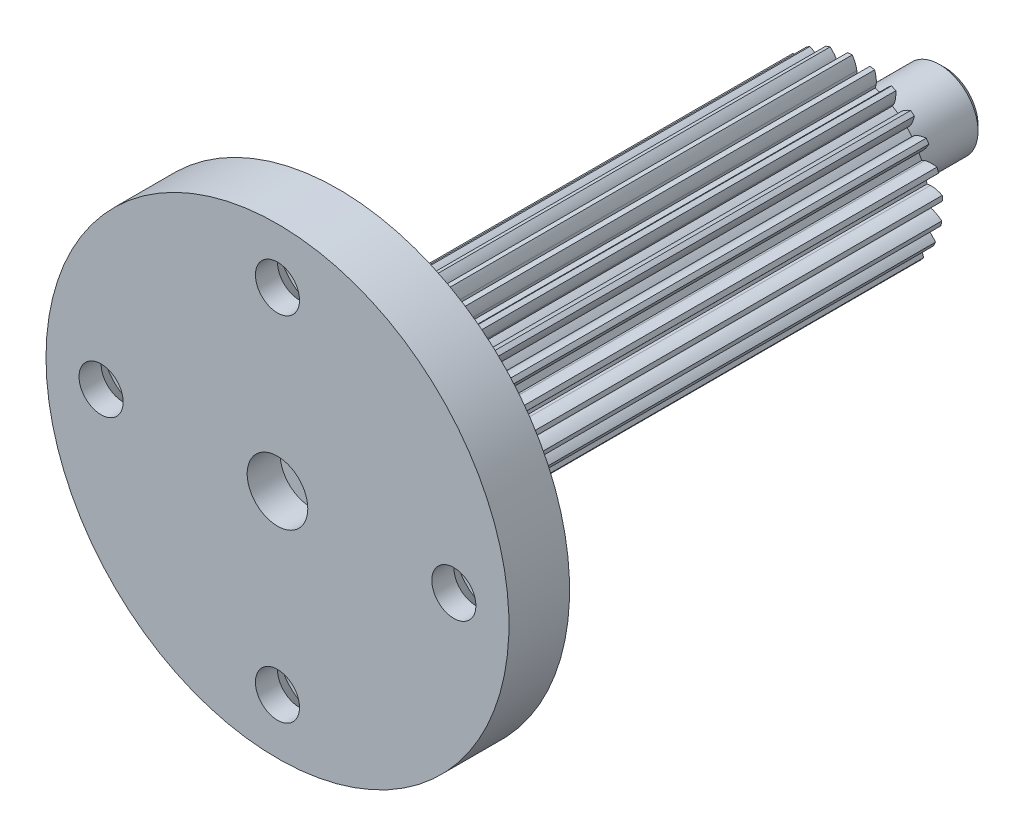
from build123d import *

# Parameters (mm, degrees)
SKETCH1_R           = 7.8
BOSS_EXTRUDE1_DEPTH = 24.27828758
CUT_EXTRUDE1_DEPTH  = 27.66674423
CIRPATTERN2_COUNT   = 24
SKETCH3_W           = 21
SKETCH3_H           = 4
CHAMFER1_SIZE       = 0.5
CHAMFER2_SIZE       = 0.5
SKETCH4_R           = 1.5
CUT_EXTRUDE2_DEPTH  = 68.447007373
SKETCH5_R           = 2.75
CUT_EXTRUDE3_DEPTH  = 3
SKETCH6_R           = 2
CUT_EXTRUDE4_DEPTH  = 64.879935835
CIRPATTERN3_COUNT   = 4
SKETCH9_R           = 21
SKETCH9_R_2         = 4
SKETCH9_R_3         = 1.5
BOSS_EXTRUDE2_DEPTH = 1.5


with BuildPart() as part:
    # Sketch1 → Boss-Extrude1 (new, symmetric)
    with BuildSketch(Plane.XY):
        Circle(SKETCH1_R)
    extrude(amount=BOSS_EXTRUDE1_DEPTH, both=True)

    # Sketch2 → Cut-Extrude1 (cut, symmetric)
    with BuildSketch(Plane.XY):
        with BuildLine():
            add(Edge.make_bspline(
                [(6.76578687, 0), (6.76809978, 3.3276e-05), (6.77458529, 0.000229652), (6.794601126, 0.001500861), (6.833998566, 0.005878077), (6.882442963, 0.013960538), (6.937880972, 0.025803911), (6.991116806, 0.039235092), (7.036448816, 0.051955872), (7.081479524, 0.06579295), (7.126153643, 0.080609438), (7.180031591, 0.099771972), (7.244294587, 0.124436007), (7.318858047, 0.155705553), (7.402735307, 0.194039552), (7.48741219, 0.236150228), (7.570046617, 0.280079073), (7.652678702, 0.327298721), (7.716306472, 0.365549898), (7.760956419, 0.393791216), (7.784989854, 0.409279886), (7.789114217, 0.411946256)],
                knots=[0, 0, 0, 0, 0, 0.005376749, 0.015083688, 0.04661014, 0.092110525, 0.119476176, 0.146842496, 0.174208854, 0.201574956, 0.228941013, 0.256307345, 0.307035032, 0.361767352, 0.416499661, 0.471231937, 0.525964282, 0.580696616, 0.635428982, 0.646811093, 0.646811093, 0.646811093, 0.646811093, 0.646811093], degree=4))
            Line((6.76578687, 0), (6.45, 0))
            ThreePointArc((6.45, 0), (6.441762383, -0.325879434), (6.417070572, -0.650926474))
            Line((6.417070572, -0.650926474), (6.731245243, -0.682795316))
            add(Edge.make_bspline(
                [(6.731245243, -0.682795316), (6.733542987, -0.683061838), (6.739975568, -0.683911722), (6.759760928, -0.687196416), (6.798515487, -0.695527228), (6.845896887, -0.708457378), (6.899856646, -0.725835026), (6.951465235, -0.744570134), (6.995282043, -0.761800823), (7.038686432, -0.780111706), (7.081637212, -0.79936101), (7.133306235, -0.823863012), (7.194752081, -0.854886476), (7.265779182, -0.893521238), (7.345359598, -0.940124324), (7.425354417, -0.990565504), (7.50313372, -1.042609447), (7.580578588, -1.097927156), (7.640021253, -1.142404288), (7.681593166, -1.175007445), (7.703940804, -1.192842466), (7.707775023, -1.195911449)],
                knots=[0, 0, 0, 0, 0, 0.005376749, 0.015083688, 0.04661014, 0.092110525, 0.119476176, 0.146842496, 0.174208854, 0.201574956, 0.228941013, 0.256307345, 0.307035032, 0.361767352, 0.416499661, 0.471231937, 0.525964282, 0.580696616, 0.635428982, 0.646811093, 0.646811093, 0.646811093, 0.646811093, 0.646811093], degree=4))
            ThreePointArc((7.707775023, -1.195911449), (7.776909578, -0.599731115), (7.8, 0))
            ThreePointArc((7.8, 0), (7.797278079, 0.20604503), (7.789114217, 0.411946256))
        make_face()
    cut_extrude1 = extrude(amount=CUT_EXTRUDE1_DEPTH, both=True, mode=Mode.SUBTRACT)

    # CirPattern2: Cut-Extrude1 ×24 about axis
    cirpattern2_axis = Axis((0, 0, -24.27828758), (0, 0, 1))
    for i in range(1, CIRPATTERN2_COUNT):
        add(cut_extrude1.rotate(cirpattern2_axis, i * 360 / CIRPATTERN2_COUNT), mode=Mode.SUBTRACT)

    # Sketch3 → Revolve1 (revolve)
    with BuildSketch(Plane(origin=(0, 0, 0), x_dir=(1, 0, 0), z_dir=(0, 1, 0))):
        Polygon((0, 24.27828758), (0, 32.27828758), (-3.5, 32.27828758), (-3.5, 25.77828758), (-4, 25.77828758), (-4, 24.27828758), align=None)
        with Locations((-10.5, -26.27828758)):
            Rectangle(SKETCH3_W, SKETCH3_H)
    revolve(axis=Axis((0, 0, -24.27828758), (0, 0, 1)))

    # Chamfer1
    chamfer1_edges = [part.edges().sort_by_distance(p)[0] for p in [
        (4, 0, -24.27828758),
    ]]
    chamfer(chamfer1_edges, length=CHAMFER1_SIZE)

    # Chamfer2
    chamfer2_edges = [part.edges().sort_by_distance(p)[0] for p in [
        (3.5, 0, -32.27828758),
    ]]
    chamfer(chamfer2_edges, length=CHAMFER2_SIZE)

    # Sketch4 → Cut-Extrude2 (cut, through all)
    with BuildSketch(Plane.XY.offset(28.27828758)):
        Circle(SKETCH4_R)
    extrude(amount=-CUT_EXTRUDE2_DEPTH, mode=Mode.SUBTRACT)

    # Sketch5 → Cut-Extrude3 (cut)
    with BuildSketch(Plane.XY.offset(28.27828758)):
        Circle(SKETCH5_R)
    extrude(amount=-CUT_EXTRUDE3_DEPTH, mode=Mode.SUBTRACT)

    # Sketch6 → Cut-Extrude4 (cut, through all)
    with BuildSketch(Plane(origin=(0, 0, 24.27828758), x_dir=(-1, 0, 0), z_dir=(0, 0, -1))):
        with Locations((0, 16)):
            Circle(SKETCH6_R)
        with Locations((16, 0)):
            Circle(SKETCH6_R)
        with Locations((0, -16)):
            Circle(SKETCH6_R)
        with Locations((-16, 0)):
            Circle(SKETCH6_R)
    extrude(amount=-CUT_EXTRUDE4_DEPTH, mode=Mode.SUBTRACT)

    # Sketch7 → Cut-Revolve1 (revolve, cut)
    with BuildSketch(Plane(origin=(0, 0, 0), x_dir=(1, 0, 0), z_dir=(0, 1, 0))):
        Polygon((20, -24.27828758), (16, -24.27828758), (16, -26.27828758), (18, -26.27828758), align=None)
    cut_revolve1 = revolve(axis=Axis((16, 0, 24.27828758), (0, 0, 1)), mode=Mode.SUBTRACT)

    # CirPattern3: Cut-Revolve1 ×4 about axis
    cirpattern3_axis = Axis((0, 0, -32.27828758), (0, 0, 1))
    for i in range(1, CIRPATTERN3_COUNT):
        add(cut_revolve1.rotate(cirpattern3_axis, i * 360 / CIRPATTERN3_COUNT), mode=Mode.SUBTRACT)

    # Sketch9 → Boss-Extrude2 (add)
    with BuildSketch(Plane(origin=(0, 0, 24.27828758), x_dir=(-1, 0, 0), z_dir=(0, 0, -1))):
        Circle(SKETCH9_R)
        with Locations((16, 0)):
            Circle(SKETCH9_R_2, mode=Mode.SUBTRACT)
        with Locations((0, -16)):
            Circle(SKETCH9_R_2, mode=Mode.SUBTRACT)
        with Locations((-16, 0)):
            Circle(SKETCH9_R_2, mode=Mode.SUBTRACT)
        with Locations((0, 16)):
            Circle(SKETCH9_R_2, mode=Mode.SUBTRACT)
        Circle(SKETCH9_R_3, mode=Mode.SUBTRACT)
    extrude(amount=BOSS_EXTRUDE2_DEPTH)

    # Sketch10 → Revolve2 (revolve)
    with BuildSketch(Plane(origin=(0, 0, 0), x_dir=(1, 0, 0), z_dir=(0, 1, 0))):
        Polygon((0, -17.77828758), (0, -22.77828758), (12, -22.77828758), (7.8, -17.77828758), align=None)
    revolve(axis=Axis((0, 0, 0), (0, 0, 1)))


solid = part.part
